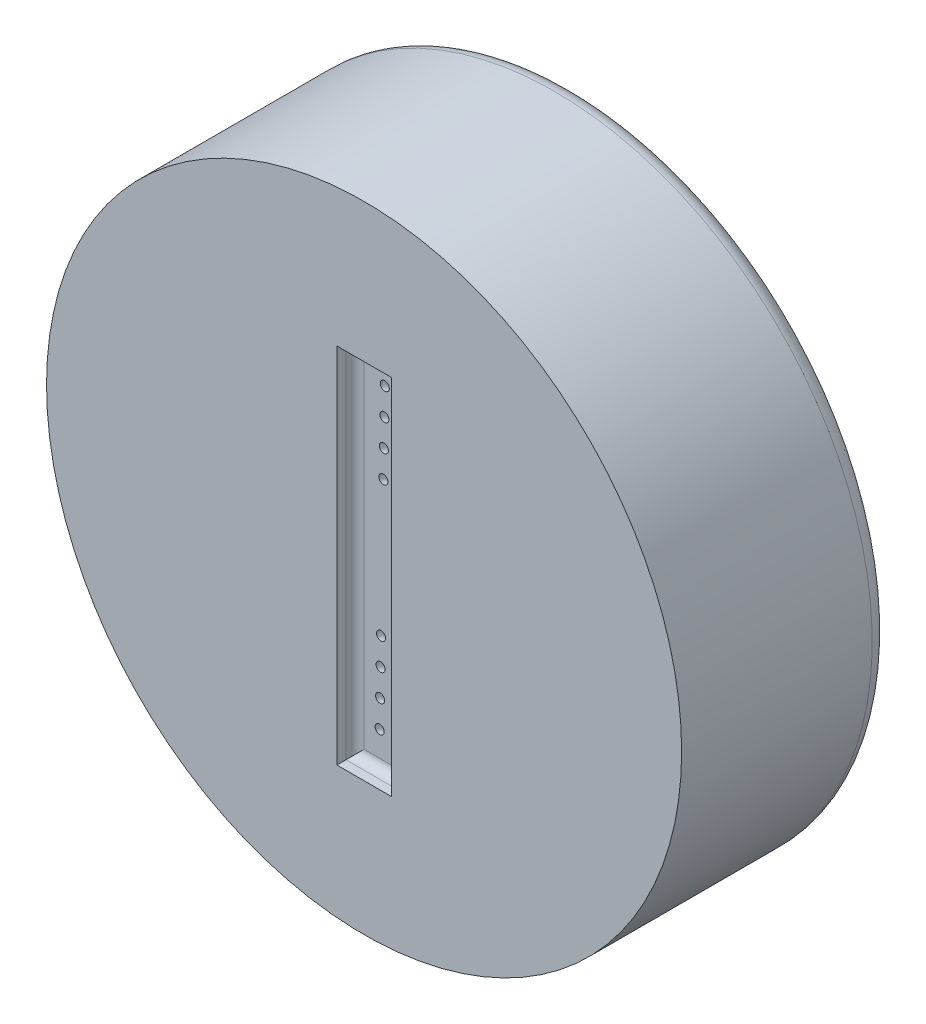
from build123d import *

# Parameters (mm, degrees)
SKETCH1_R           = 35
SKETCH1_R_2         = 0.5
BOSS_EXTRUDE1_DEPTH = 4
SKETCH2_W           = 6
SKETCH2_H           = 40
CUT_EXTRUDE1_DEPTH  = 2
FILLET1_R           = 1
EXTRUDE_THIN1_START = 19
SKETCH3_R           = 35
SKETCH3_R_2         = 30
EXTRUDE_THIN1_DEPTH = 19
FILLET2_R           = 2
FILLET3_R           = 2


with BuildPart() as part:
    # Sketch1 → Boss-Extrude1 (new body)
    with BuildSketch(Plane.XY):
        with Locations((0, 10.3)):
            Circle(SKETCH1_R)
        with Locations((0.282034844, 26.827593786)):
            Circle(SKETCH1_R_2, mode=Mode.SUBTRACT)
        with Locations((0.230848847, 23.828030485)):
            Circle(SKETCH1_R_2, mode=Mode.SUBTRACT)
        with Locations((0.17966285, 20.828467185)):
            Circle(SKETCH1_R_2, mode=Mode.SUBTRACT)
        with Locations((0.128476853, 17.828903884)):
            Circle(SKETCH1_R_2, mode=Mode.SUBTRACT)
        with Locations((-0.128476853, 2.771096116)):
            Circle(SKETCH1_R_2, mode=Mode.SUBTRACT)
        with Locations((-0.17966285, -0.228467185)):
            Circle(SKETCH1_R_2, mode=Mode.SUBTRACT)
        with Locations((-0.230848847, -3.228030485)):
            Circle(SKETCH1_R_2, mode=Mode.SUBTRACT)
        with Locations((-0.282034844, -6.227593786)):
            Circle(SKETCH1_R_2, mode=Mode.SUBTRACT)
    extrude(amount=BOSS_EXTRUDE1_DEPTH)

    # Sketch2 → Cut-Extrude1 (cut)
    with BuildSketch(Plane.XY.offset(4)):
        with Locations((0, 10)):
            Rectangle(SKETCH2_W, SKETCH2_H)
    extrude(amount=-CUT_EXTRUDE1_DEPTH, mode=Mode.SUBTRACT)

    # Fillet1
    fillet1_edges = [part.edges().sort_by_distance(p)[0] for p in [
        (-3, 10, 2),
        (0, 30, 2),
        (3, 10, 2),
        (0, -10, 2),
    ]]
    fillet(fillet1_edges, radius=FILLET1_R)

    # Sketch3 → Extrude-Thin1 (add)
    with BuildSketch(Plane(origin=(0, 0, 0), x_dir=(-1, 0, 0), z_dir=(0, 0, -1)).offset(EXTRUDE_THIN1_START)):
        with Locations((0, 10.3)):
            Circle(SKETCH3_R)
        with Locations((0, 10.3)):
            Circle(SKETCH3_R_2, mode=Mode.SUBTRACT)
    extrude(amount=-EXTRUDE_THIN1_DEPTH)

    # Fillet2
    # the kernel refuses this fillet: 2 mm, written as the material it adds along each edge
    with BuildSketch(Plane(origin=(0, 10.3, 0), x_dir=(-1, 0, 0), z_dir=(0, -1, 0))) as fillet2_piece_1:
        with BuildLine():
            CenterArc((30 - FILLET2_R, FILLET2_R), FILLET2_R, 270, 90)
            Line((30, FILLET2_R), (30, 0))
            Line((30, 0), (30 - FILLET2_R, 0))
        make_face()
    revolve(axis=Axis((0, 10.3, 0), (0, 0, -1)))
    # the kernel refuses this fillet: 2 mm, written as the material it takes off along each edge
    with BuildSketch(Plane(origin=(0.17966285, 20.828467185, 0), x_dir=(1, 0, 0), z_dir=(0, -1, 0))) as fillet2_2_piece_1:
        with BuildLine():
            CenterArc((0.5 + FILLET2_R, FILLET2_R), FILLET2_R, 180, 90)
            Line((0.5 + FILLET2_R, 0), (0.5, 0))
            Line((0.5, 0), (0.5, FILLET2_R))
        make_face()
    revolve(axis=Axis((0.17966285, 20.828467185, 0), (0, 0, 1)), mode=Mode.SUBTRACT)
    with BuildSketch(Plane(origin=(0.128476853, 17.828903884, 0), x_dir=(1, 0, 0), z_dir=(0, -1, 0))) as fillet2_2_piece_2:
        with BuildLine():
            CenterArc((0.5 + FILLET2_R, FILLET2_R), FILLET2_R, 180, 90)
            Line((0.5 + FILLET2_R, 0), (0.5, 0))
            Line((0.5, 0), (0.5, FILLET2_R))
        make_face()
    revolve(axis=Axis((0.128476853, 17.828903884, 0), (0, 0, 1)), mode=Mode.SUBTRACT)
    with BuildSketch(Plane(origin=(-0.128476853, 2.771096116, 0), x_dir=(1, 0, 0), z_dir=(0, -1, 0))) as fillet2_2_piece_3:
        with BuildLine():
            CenterArc((0.5 + FILLET2_R, FILLET2_R), FILLET2_R, 180, 90)
            Line((0.5 + FILLET2_R, 0), (0.5, 0))
            Line((0.5, 0), (0.5, FILLET2_R))
        make_face()
    revolve(axis=Axis((-0.128476853, 2.771096116, 0), (0, 0, 1)), mode=Mode.SUBTRACT)
    with BuildSketch(Plane(origin=(-0.17966285, -0.228467185, 0), x_dir=(1, 0, 0), z_dir=(0, -1, 0))) as fillet2_2_piece_4:
        with BuildLine():
            CenterArc((0.5 + FILLET2_R, FILLET2_R), FILLET2_R, 180, 90)
            Line((0.5 + FILLET2_R, 0), (0.5, 0))
            Line((0.5, 0), (0.5, FILLET2_R))
        make_face()
    revolve(axis=Axis((-0.17966285, -0.228467185, 0), (0, 0, 1)), mode=Mode.SUBTRACT)
    with BuildSketch(Plane(origin=(-0.230848847, -3.228030485, 0), x_dir=(1, 0, 0), z_dir=(0, -1, 0))) as fillet2_2_piece_5:
        with BuildLine():
            CenterArc((0.5 + FILLET2_R, FILLET2_R), FILLET2_R, 180, 90)
            Line((0.5 + FILLET2_R, 0), (0.5, 0))
            Line((0.5, 0), (0.5, FILLET2_R))
        make_face()
    revolve(axis=Axis((-0.230848847, -3.228030485, 0), (0, 0, 1)), mode=Mode.SUBTRACT)
    with BuildSketch(Plane(origin=(-0.282034844, -6.227593786, 0), x_dir=(1, 0, 0), z_dir=(0, -1, 0))) as fillet2_2_piece_6:
        with BuildLine():
            CenterArc((0.5 + FILLET2_R, FILLET2_R), FILLET2_R, 180, 90)
            Line((0.5 + FILLET2_R, 0), (0.5, 0))
            Line((0.5, 0), (0.5, FILLET2_R))
        make_face()
    revolve(axis=Axis((-0.282034844, -6.227593786, 0), (0, 0, 1)), mode=Mode.SUBTRACT)
    with BuildSketch(Plane(origin=(0.282034844, 26.827593786, 0), x_dir=(1, 0, 0), z_dir=(0, -1, 0))) as fillet2_2_piece_7:
        with BuildLine():
            CenterArc((0.5 + FILLET2_R, FILLET2_R), FILLET2_R, 180, 90)
            Line((0.5 + FILLET2_R, 0), (0.5, 0))
            Line((0.5, 0), (0.5, FILLET2_R))
        make_face()
    revolve(axis=Axis((0.282034844, 26.827593786, 0), (0, 0, 1)), mode=Mode.SUBTRACT)
    with BuildSketch(Plane(origin=(0.230848847, 23.828030485, 0), x_dir=(1, 0, 0), z_dir=(0, -1, 0))) as fillet2_2_piece_8:
        with BuildLine():
            CenterArc((0.5 + FILLET2_R, FILLET2_R), FILLET2_R, 180, 90)
            Line((0.5 + FILLET2_R, 0), (0.5, 0))
            Line((0.5, 0), (0.5, FILLET2_R))
        make_face()
    revolve(axis=Axis((0.230848847, 23.828030485, 0), (0, 0, 1)), mode=Mode.SUBTRACT)

    # Fillet3
    fillet3_edges = [part.edges().sort_by_distance(p)[0] for p in [
        (35, 10.3, -19),
        (30, 10.3, -19),
    ]]
    fillet(fillet3_edges, radius=FILLET3_R)


solid = part.part
